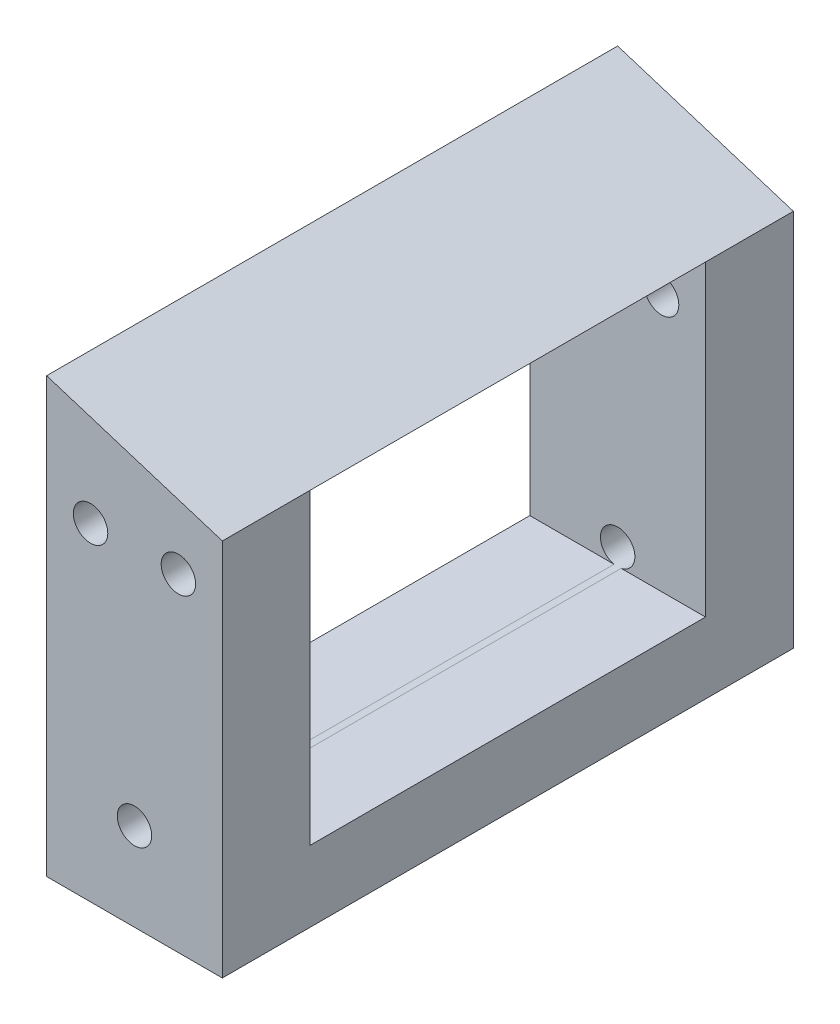
from build123d import *

# Parameters (mm, degrees)
SKETCH2_R           = 2.4892
BOSS_EXTRUDE1_DEPTH = 82.55
SKETCH3_R           = 2.4892
CUT_EXTRUDE1_DEPTH  = 703.404204717
SKETCH4_W           = 57.15
SKETCH4_H           = 44.45
CUT_EXTRUDE2_DEPTH  = 702.456359515
SKETCH5_R           = 2.5781
CUT_EXTRUDE3_DEPTH  = 6.35


with BuildPart() as part:
    # Sketch2 → Boss-Extrude1 (new body)
    with BuildSketch(Plane.XY):
        Polygon((19.05, 696.118784264), (44.45, 688.126694948), (44.45, 633.411738), (19.05, 633.411738), align=None)
        with Locations((25.4, 680.806920531)):
            Circle(SKETCH2_R, mode=Mode.SUBTRACT)
        with Locations((38.1, 680.806920531)):
            Circle(SKETCH2_R, mode=Mode.SUBTRACT)
    extrude(amount=-BOSS_EXTRUDE1_DEPTH)

    # Sketch3 → Cut-Extrude1 (cut, through all)
    with BuildSketch(Plane.XY):
        with Locations((31.75, 646.111738)):
            Circle(SKETCH3_R)
    extrude(amount=-CUT_EXTRUDE1_DEPTH, mode=Mode.SUBTRACT)

    # Sketch4 → Cut-Extrude2 (cut, through all)
    with BuildSketch(Plane(origin=(44.45, 0, 0), x_dir=(0, 0, -1), z_dir=(1, 0, 0))):
        with Locations((41.275, 665.901694948)):
            Rectangle(SKETCH4_W, SKETCH4_H)
    extrude(amount=-CUT_EXTRUDE2_DEPTH, mode=Mode.SUBTRACT)

    # Sketch5 → Cut-Extrude3 (cut)
    with BuildSketch(Plane.XZ.offset(-633.411738)):
        with Locations((26.9875, -41.275)):
            Circle(SKETCH5_R)
    extrude(amount=-CUT_EXTRUDE3_DEPTH, mode=Mode.SUBTRACT)


solid = part.part
